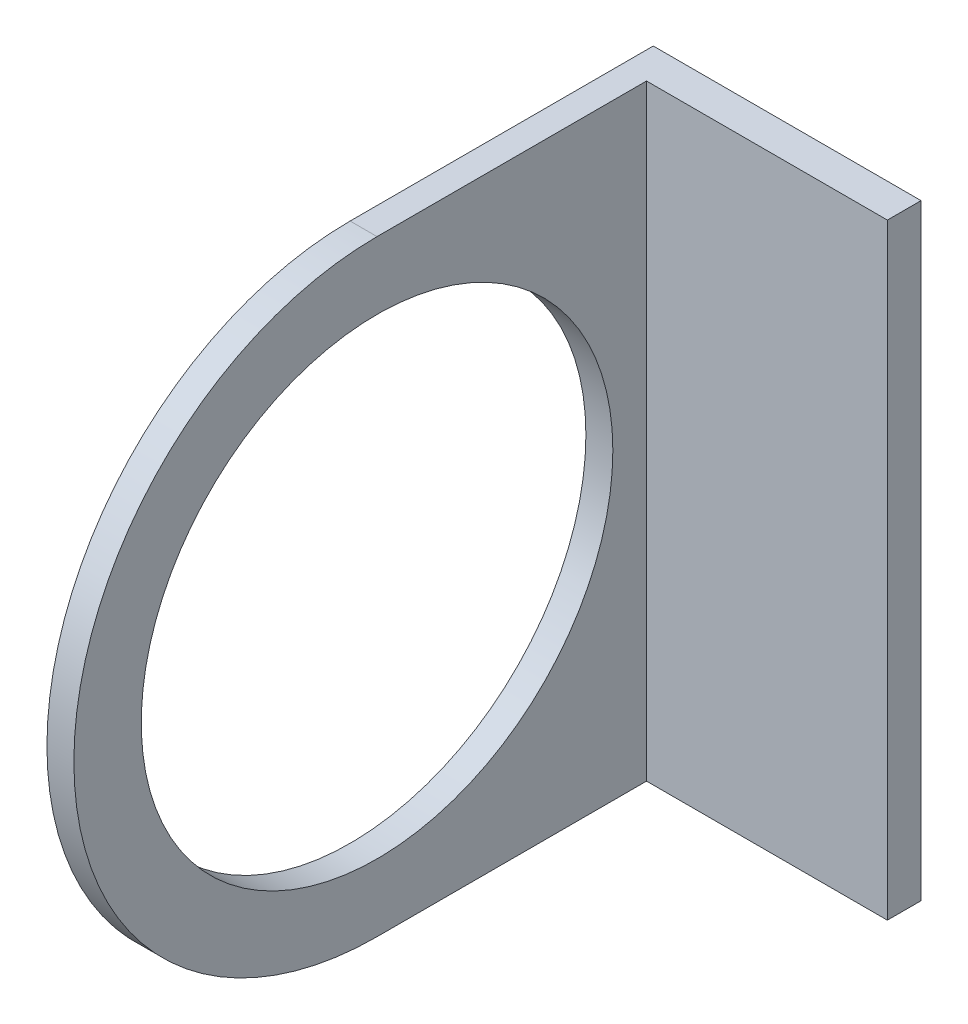
from build123d import *

# Parameters (mm, degrees)
EXTRUDE_1_DEPTH     = 180
SKETCH_2_R          = 70
CUT_EXTRUDE_1_DEPTH = 180
SKETCH_5_W          = 10
SKETCH_5_H          = 180
EXTRUDE_3_DEPTH     = 71.5


with BuildPart() as part:
    # 草图1 → 凸台-拉伸1 (new body)
    with BuildSketch(Plane(origin=(0, 0, 0), x_dir=(1, 0, 0), z_dir=(0, 1, 0))):
        Polygon((8, -10), (8, -300), (0, -300), (0, 0), (8, 0), align=None)
    extrude(amount=EXTRUDE_1_DEPTH)

    # 草图2 → 切除-拉伸1 (cut)
    with BuildSketch(Plane(origin=(8, 0, 0), x_dir=(0, 0, -1), z_dir=(1, 0, 0))):
        with Locations((-90, 90)):
            Circle(SKETCH_2_R)
        with BuildLine():
            Line((-90, 0), (-300, 0))
            Line((-300, 0), (-300, 180))
            Line((-300, 180), (-90, 180))
            ThreePointArc((-90, 180), (-180, 90), (-90, 0))
        make_face()
    extrude(amount=-CUT_EXTRUDE_1_DEPTH, mode=Mode.SUBTRACT)

    # 草图5 → 凸台-拉伸3 (add)
    with BuildSketch(Plane(origin=(8, 0, 0), x_dir=(0, 0, -1), z_dir=(1, 0, 0))):
        with Locations((-5, 90)):
            Rectangle(SKETCH_5_W, SKETCH_5_H)
    extrude(amount=EXTRUDE_3_DEPTH)


solid = part.part
